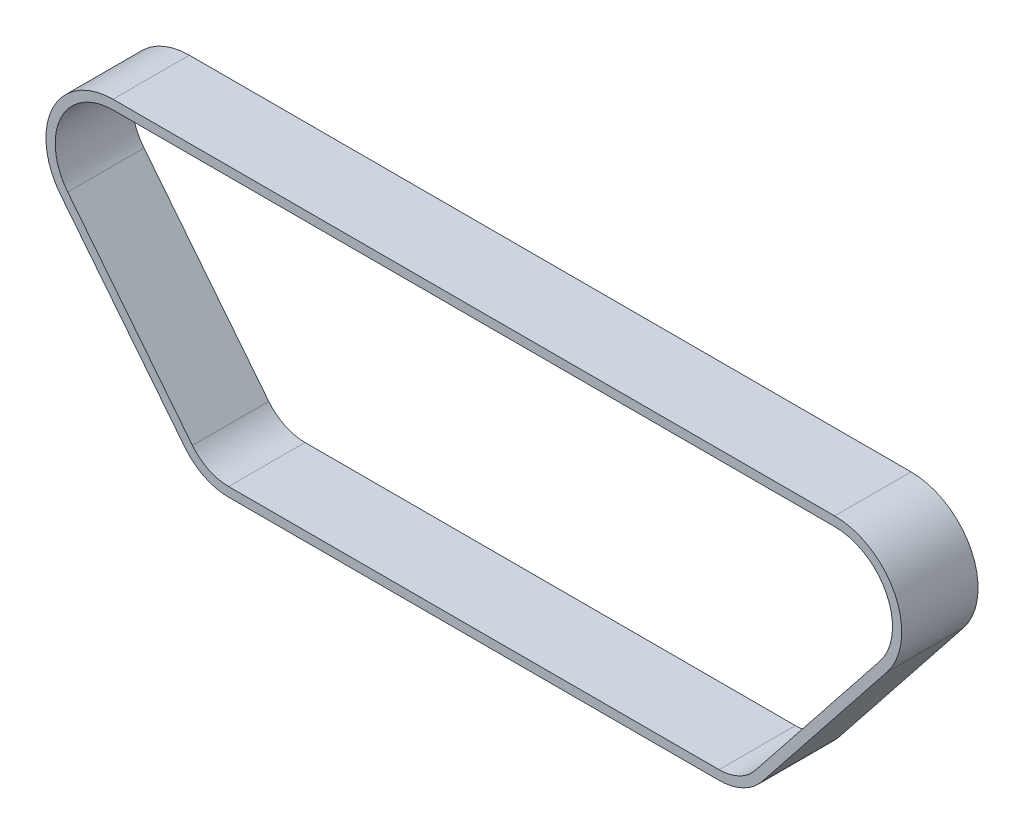
from build123d import *

# Parameters (mm, degrees)
BOSS_EXTRUDE1_DEPTH = 8.25


with BuildPart() as part:
    # Sketch1 → Boss-Extrude1 (new, symmetric)
    with BuildSketch(Plane.XY):
        with BuildLine():
            Line((-156, 14.5), (0, 14.5))
            ThreePointArc((0, 14.5), (13.057648112, 6.304587678), (11.354908605, -9.017541271))
            Line((11.354908605, -9.017541271), (-15.602834258, -42.962792776))
            ThreePointArc((-15.602834258, -42.962792776), (-19.782410198, -46.306329472), (-25, -47.5))
            Line((-25, -47.5), (-131, -47.5))
            ThreePointArc((-131, -47.5), (-136.217589802, -46.306329472), (-140.397165742, -42.962792776))
            Line((-140.397165742, -42.962792776), (-167.354908605, -9.017541271))
            ThreePointArc((-167.354908605, -9.017541271), (-169.057648112, 6.304587678), (-156, 14.5))
        make_face()
        with BuildLine():
            Line((-156, 12.5), (0, 12.5))
            ThreePointArc((0, 12.5), (11.2565932, 5.434989377), (9.788714315, -7.773742475))
            Line((9.788714315, -7.773742475), (-17.169028548, -41.71899398))
            ThreePointArc((-17.169028548, -41.71899398), (-20.652008498, -44.50527456), (-25, -45.5))
            Line((-25, -45.5), (-131, -45.5))
            ThreePointArc((-131, -45.5), (-135.347991502, -44.50527456), (-138.830971452, -41.71899398))
            Line((-138.830971452, -41.71899398), (-165.788714315, -7.773742475))
            ThreePointArc((-165.788714315, -7.773742475), (-167.2565932, 5.434989377), (-156, 12.5))
        make_face(mode=Mode.SUBTRACT)
    extrude(amount=BOSS_EXTRUDE1_DEPTH, both=True)


solid = part.part
